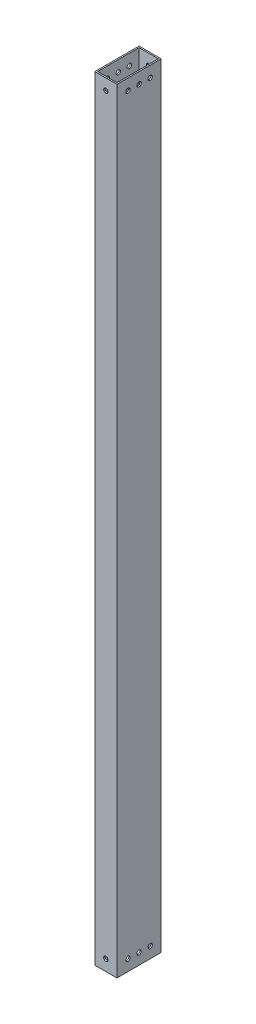
from build123d import *

# Parameters (mm, degrees)
SKETCH1_W              = 25.4
SKETCH1_H              = 50.8
SKETCH1_W_2            = 22.225
SKETCH1_H_2            = 47.625
EXTRUDE_THIN1_DEPTH    = 889
F_10_CLEARANCE_HOLE1_D = 5.1054
F_10_CLEARANCE_HOLE2_D = 5.1054


with BuildPart() as part:
    # Sketch1 → Extrude-Thin1 (new body)
    with BuildSketch(Plane(origin=(0, 0, 0), x_dir=(1, 0, 0), z_dir=(0, 1, 0))):
        Rectangle(SKETCH1_W, SKETCH1_H)
        Rectangle(SKETCH1_W_2, SKETCH1_H_2, mode=Mode.SUBTRACT)
    extrude(amount=EXTRUDE_THIN1_DEPTH)

    # #10 Clearance Hole1 (through all)
    with Locations(Plane.ZY.offset(12.7)):
        with Locations((-12.7, 876.3), (0, 876.3), (12.7, 876.3), (-12.7, 12.7), (0, 12.7), (12.7, 12.7)):
            Hole(F_10_CLEARANCE_HOLE1_D / 2)

    # #10 Clearance Hole2 (through all)
    with Locations(Plane.XY.offset(25.4)):
        with Locations((0, 876.3), (0, 12.7)):
            Hole(F_10_CLEARANCE_HOLE2_D / 2)


solid = part.part
